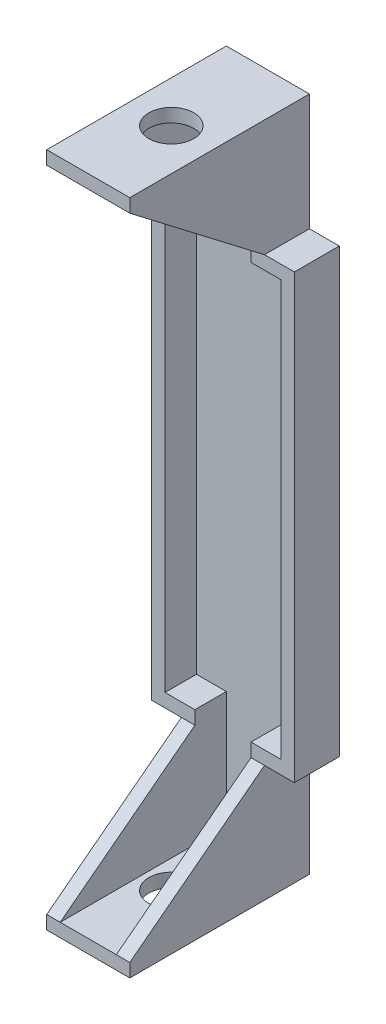
from build123d import *

# Parameters (mm, degrees)
BOSS_EXTRUDE11_DEPTH    = 40
SKETCH17_W              = 47.22521337
SKETCH17_H              = 85.181086333
CUT_EXTRUDE6_DEPTH      = 30
SHELL3_START            = -37.625
SHELL3_OUTLINE_W        = 25.8
SHELL3_OUTLINE_H        = 7
SHELL3_DEPTH            = 46.25
SHELL3_START_2          = 8.625
SHELL3_2_OUTLINE_W      = 12.5
SHELL3_2_OUTLINE_H      = 7
SHELL3_2_DEPTH          = 26
SKETCH18_W              = 54.471727392
SKETCH18_H              = 147.372956823
CUT_EXTRUDE7_DEPTH      = 308
BOSS_EXTRUDE12_DEPTH    = 3
BOSS_EXTRUDE13_DEPTH    = 2
CUT_EXTRUDE8_DEPTH      = 154.652399916
CUT_EXTRUDE8_DEPTH_BACK = 154.652399916
SKETCH21_R              = 5


# Read off the part's stored shape, not the designer's step: Shell3
with BuildPart() as part:
    # Sketch16 → Boss-Extrude11 (new body)
    with BuildSketch(Plane.XY):
        Polygon((-15.9, -37.625), (15.9, -37.625), (15.9, 11.625), (9.25, 11.625), (9.25, 37.625), (-9.25, 37.625), (-9.25, 11.625), (-15.9, 11.625), align=None)
    extrude(amount=BOSS_EXTRUDE11_DEPTH)

    # Sketch17 → Cut-Extrude6 (cut)
    with BuildSketch(Plane.XY.offset(40)):
        with Locations((3.242513711, -7.965543167)):
            Rectangle(SKETCH17_W, SKETCH17_H)
    extrude(amount=-CUT_EXTRUDE6_DEPTH, mode=Mode.SUBTRACT)

    # Shell3 outline → Shell3 (cut)
    with BuildSketch(Plane(origin=(0, 0, 0), x_dir=(1, 0, 0), z_dir=(0, 1, 0)).offset(SHELL3_START)):
        with Locations((0, -6.5)):
            Rectangle(SHELL3_OUTLINE_W, SHELL3_OUTLINE_H)
    extrude(amount=SHELL3_DEPTH, mode=Mode.SUBTRACT)

    # Shell3 2 outline → Shell3 2 (cut)
    with BuildSketch(Plane(origin=(0, 0, 0), x_dir=(1, 0, 0), z_dir=(0, 1, 0)).offset(SHELL3_START_2)):
        with Locations((0, -6.5)):
            Rectangle(SHELL3_2_OUTLINE_W, SHELL3_2_OUTLINE_H)
    extrude(amount=SHELL3_2_DEPTH, mode=Mode.SUBTRACT)

    # Sketch18 → Cut-Extrude7 (cut)
    with BuildSketch(Plane.XY.offset(40)):
        with Locations((-27.235863696, -36.061478412)):
            Rectangle(SKETCH18_W, SKETCH18_H)
    extrude(amount=-CUT_EXTRUDE7_DEPTH, mode=Mode.SUBTRACT)

    # Sketch19 → Boss-Extrude12 (add)
    with BuildSketch(Plane(origin=(9.25, 0, 0), x_dir=(0, 0, -1), z_dir=(1, 0, 0))):
        Polygon((-40, 34.625), (-10, 11.625), (-10, 34.625), align=None)
    extrude(amount=-BOSS_EXTRUDE12_DEPTH)

    # Sketch20 → Boss-Extrude13 (add)
    with BuildSketch(Plane.ZY.offset(-6.25)):
        Polygon((3, 34.625), (8, 34.625), (3, 31.625), align=None)
    extrude(amount=BOSS_EXTRUDE13_DEPTH)

    # Mirror3: part across plane


with BuildPart() as part_1:
    add(part.part)
    add(part.part.mirror(Plane(origin=(0, 37.625, -268), x_dir=(0, 0, 1), z_dir=(1, 0, 0))))

    # Mirror4: part across plane


with BuildPart() as part_2:
    add(part_1.part)
    add(part_1.part.mirror(Plane(origin=(-15.9, -37.625, 40), x_dir=(0, 0, 1), z_dir=(0, 1, 0))))

    # Sketch21 → Cut-Extrude8 (cut, two sides: drawn at the far end of the back side and taken through both)
    with BuildSketch(Plane.XZ.offset(-34.625).offset(-CUT_EXTRUDE8_DEPTH_BACK)):
        with Locations(Location((0, 21.5, 0), (0, 0, 270))):
            Circle(SKETCH21_R)
    extrude(amount=CUT_EXTRUDE8_DEPTH + CUT_EXTRUDE8_DEPTH_BACK, mode=Mode.SUBTRACT)


solid = part_2.part
